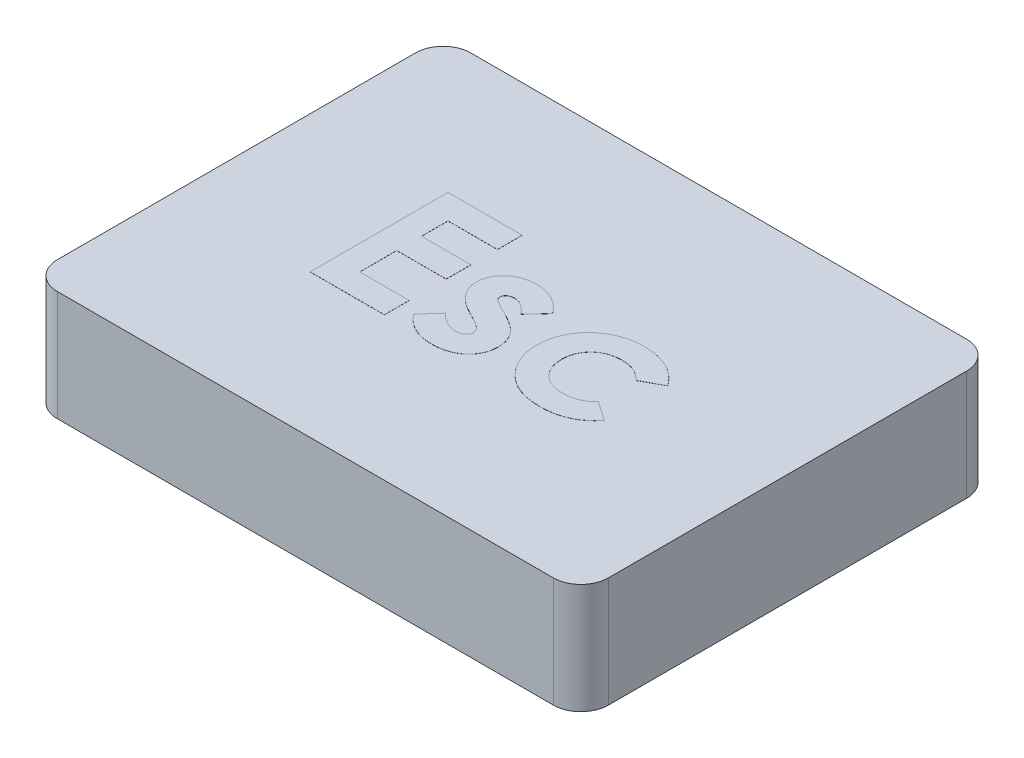
from build123d import *

# Parameters (mm, degrees)
SKETCH1_W           = 12.7
SKETCH1_H           = 9.525
BOSS_EXTRUDE1_DEPTH = 2.54
FILLET1_R           = 0.635
SHELL1_START        = 0.635
SHELL1_OUTLINE_W    = 1.905
SHELL1_OUTLINE_H    = 8.255
SHELL1_DEPTH        = 11.43
SKETCH2_R           = 2.54
BOSS_EXTRUDE2_DEPTH = 1.905
BOSS_EXTRUDE3_DEPTH = 0.00254


# Read off the part's stored shape, not the designer's step: Shell1
with BuildPart() as part:
    # Sketch1 → Boss-Extrude1 (new body)
    with BuildSketch(Plane(origin=(0, 0, 0), x_dir=(1, 0, 0), z_dir=(0, 1, 0))):
        with Locations((6.35, 4.7625)):
            Rectangle(SKETCH1_W, SKETCH1_H)
    extrude(amount=BOSS_EXTRUDE1_DEPTH)

    # Fillet1
    fillet1_edges = [part.edges().sort_by_distance(p)[0] for p in [
        (0, 1.27, -9.525),
        (12.7, 1.27, -9.525),
        (12.7, 1.27, 0),
        (0, 1.27, 0),
    ]]
    fillet(fillet1_edges, radius=FILLET1_R)

    # Shell1 outline → Shell1 (cut)
    with BuildSketch(Plane.YZ.offset(SHELL1_START)):
        with Locations((0.9525, -4.7625)):
            Rectangle(SHELL1_OUTLINE_W, SHELL1_OUTLINE_H)
    extrude(amount=SHELL1_DEPTH, mode=Mode.SUBTRACT)

    # Sketch2 → Boss-Extrude2 (add)
    with BuildSketch(Plane(origin=(0, 1.905, 0), x_dir=(-1, 0, 0), z_dir=(0, -1, 0))):
        with Locations(Location((-6.35, 4.7625, 0), (0, 0, 270))):
            Circle(SKETCH2_R)
    extrude(amount=BOSS_EXTRUDE2_DEPTH)

    # Sketch3 → Boss-Extrude3 (add)
    with BuildSketch(Plane(origin=(0, 2.54, 0), x_dir=(1, 0, 0), z_dir=(0, 1, 0))):
        Polygon((3.160346154, 6.477), (4.869961538, 6.477), (4.869961538, 5.907128205), (3.730217949, 5.907128205), (3.730217949, 5.296551282), (4.869961538, 5.296551282), (4.869961538, 4.726679487), (3.730217949, 4.726679487), (3.730217949, 3.871871795), (4.869961538, 3.871871795), (4.869961538, 3.302), (3.160346154, 3.302), align=None)
        with BuildLine():
            Line((6.783102564, 5.264114383), (6.434564904, 4.8895))
            add(Edge.make_bspline(
                [(6.434564904, 4.8895), (6.417160749, 4.908758641), (6.383873193, 4.945593127), (6.332913162, 4.995806763), (6.282712025, 5.037619888), (6.234205277, 5.072744656), (6.186402237, 5.099681155), (6.139700254, 5.119061362), (6.094076923, 5.131364206), (6.06383585, 5.132956762), (6.049138221, 5.133730769)],
                knots=[0, 0, 0, 0, 1.327646587, 2.539285, 3.655602211, 4.666613517, 5.598770349, 6.454635452, 7.248928967, 8, 8, 8, 8], degree=3))
            add(Edge.make_bspline(
                [(6.049138221, 5.133730769), (6.034265698, 5.133277506), (6.005789441, 5.132409647), (5.965603063, 5.124965596), (5.930296641, 5.112078571), (5.900421155, 5.094512355), (5.876418661, 5.072872582), (5.859613395, 5.048117191), (5.848328505, 5.021016135), (5.847373876, 5.001765207), (5.846884615, 4.991898838)],
                knots=[0, 0, 0, 0, 1.295068245, 2.479652818, 3.543291146, 4.55379989, 5.481948265, 6.332409746, 7.145336708, 8, 8, 8, 8], degree=3))
            add(Edge.make_bspline(
                [(5.846884615, 4.991898838), (5.848542275, 4.976947025), (5.851981726, 4.945923748), (5.875605984, 4.909941376), (5.906862583, 4.883397917), (5.942892404, 4.858697704), (5.991686109, 4.831080222), (6.028702252, 4.812169724), (6.049138221, 4.801729567)],
                knots=[0, 0, 0, 0, 0.916701701, 1.902049539, 2.5493345, 3.440293453, 4.586830489, 6, 6, 6, 6], degree=3))
            Line((6.049138221, 4.801729567), (6.255207933, 4.697422676))
            add(Edge.make_bspline(
                [(6.255207933, 4.697422676), (6.28142394, 4.684111039), (6.332287919, 4.658283963), (6.403797908, 4.616608507), (6.469845675, 4.576213663), (6.529106319, 4.534814403), (6.581942555, 4.493129972), (6.627979088, 4.450748166), (6.668332537, 4.409012568), (6.713332298, 4.353056541), (6.758345564, 4.278527666), (6.795872647, 4.181606337), (6.819803212, 4.077824904), (6.822450854, 4.005993817), (6.823807692, 3.969182492)],
                knots=[0, 0, 0, 0, 1.076693506, 2.088987655, 3.030641824, 3.911722491, 4.735175175, 5.493635918, 6.202154166, 6.859459289, 8.120623445, 9.372284821, 10.653373066, 12, 12, 12, 12], degree=3))
            add(Edge.make_bspline(
                [(6.823807692, 3.969182492), (6.822990188, 3.944348007), (6.821390116, 3.895740329), (6.811274798, 3.824194462), (6.793105067, 3.756164935), (6.769193729, 3.690591305), (6.736985872, 3.628659341), (6.697883956, 3.57006882), (6.652505415, 3.51405048), (6.599650601, 3.462520598), (6.541749036, 3.414495312), (6.477381675, 3.374102598), (6.409394564, 3.338588119), (6.335991589, 3.310854473), (6.258202687, 3.288369854), (6.175361045, 3.272788577), (6.087747764, 3.26298288), (6.027752836, 3.261867095), (5.996984776, 3.261294872)],
                knots=[0, 0, 0, 0, 0.976600749, 1.911466839, 2.833459288, 3.740827163, 4.650527853, 5.570709661, 6.506801416, 7.479409329, 8.468875524, 9.458587492, 10.461481786, 11.480119772, 12.538142914, 13.641687514, 14.790552763, 16, 16, 16, 16], degree=3))
            add(Edge.make_bspline(
                [(5.996984776, 3.261294872), (5.956219739, 3.262593012), (5.87620156, 3.265141146), (5.759340804, 3.282891086), (5.648993226, 3.313616532), (5.54506804, 3.356658951), (5.446928719, 3.411506792), (5.355976804, 3.479560957), (5.270635559, 3.559048346), (5.220983136, 3.620011473), (5.195602564, 3.651173678)],
                knots=[0, 0, 0, 0, 1.056901255, 2.07460411, 3.05625841, 4.019970729, 4.984811261, 5.963335951, 6.958928997, 8, 8, 8, 8], degree=3))
            Line((5.195602564, 3.651173678), (5.540960136, 4.034692308))
            add(Edge.make_bspline(
                [(5.540960136, 4.034692308), (5.557787123, 4.016944163), (5.591194196, 3.981708292), (5.647505021, 3.935245032), (5.707085862, 3.892897189), (5.770599997, 3.857338818), (5.834126965, 3.828627034), (5.895075849, 3.807089179), (5.952298001, 3.793554091), (5.989502369, 3.791456934), (6.007161058, 3.790461538)],
                knots=[0, 0, 0, 0, 1.087861918, 2.159761696, 3.243809206, 4.338405912, 5.394481878, 6.343674753, 7.213841449, 8, 8, 8, 8], degree=3))
            add(Edge.make_bspline(
                [(6.007161058, 3.790461538), (6.024810188, 3.790972669), (6.058736687, 3.791955203), (6.106955028, 3.802175487), (6.149693165, 3.819357293), (6.185936696, 3.843180303), (6.216083096, 3.87052548), (6.237324526, 3.901603435), (6.251370485, 3.934557895), (6.253077607, 3.9575984), (6.253935897, 3.969182492)],
                knots=[0, 0, 0, 0, 1.255011871, 2.412479185, 3.488767498, 4.514443302, 5.48617286, 6.365347346, 7.178144445, 8, 8, 8, 8], degree=3))
            add(Edge.make_bspline(
                [(6.253935897, 3.969182492), (6.253170047, 3.980091353), (6.25159761, 4.002489349), (6.23914857, 4.035550392), (6.219603332, 4.06828613), (6.192495154, 4.100788859), (6.157463327, 4.132794859), (6.11463322, 4.164047771), (6.064992926, 4.196214977), (6.028325779, 4.215414491), (6.009069111, 4.225497596)],
                knots=[0, 0, 0, 0, 0.704666567, 1.446816302, 2.258757648, 3.165368109, 4.175243826, 5.322435858, 6.59381024, 8, 8, 8, 8], degree=3))
            Line((6.009069111, 4.225497596), (5.820171875, 4.32090024))
            add(Edge.make_bspline(
                [(5.820171875, 4.32090024), (5.777322441, 4.343877821), (5.695067594, 4.387986161), (5.583889789, 4.463622589), (5.489793828, 4.544139073), (5.412703029, 4.62910305), (5.351276928, 4.71827609), (5.308428102, 4.812793541), (5.281472276, 4.911759356), (5.278506704, 4.979433254), (5.277012821, 5.013523437)],
                knots=[0, 0, 0, 0, 1.255999728, 2.41104856, 3.467751088, 4.449286722, 5.368722015, 6.253902015, 7.120417131, 8, 8, 8, 8], degree=3))
            add(Edge.make_bspline(
                [(5.277012821, 5.013523437), (5.277530887, 5.035617491), (5.278547935, 5.078991706), (5.289375024, 5.142689748), (5.305732433, 5.20391976), (5.328814498, 5.262778979), (5.358382221, 5.319325811), (5.394607812, 5.373309305), (5.437933218, 5.424631319), (5.486971412, 5.473126533), (5.541380828, 5.517293212), (5.599606904, 5.556435217), (5.661477421, 5.589776928), (5.727500139, 5.616359311), (5.796835876, 5.637517234), (5.869942321, 5.65189888), (5.946507567, 5.661045658), (5.998865985, 5.662271431), (6.025605569, 5.662897436)],
                knots=[0, 0, 0, 0, 0.959035663, 1.882742823, 2.798841253, 3.708806893, 4.623422363, 5.566085165, 6.527241613, 7.536786942, 8.55815439, 9.567237405, 10.580975912, 11.605536372, 12.654523293, 13.725718749, 14.838518481, 16, 16, 16, 16], degree=3))
            add(Edge.make_bspline(
                [(6.025605569, 5.662897436), (6.062573217, 5.661680308), (6.135947476, 5.659264525), (6.244160078, 5.639715992), (6.348682227, 5.60685942), (6.449220899, 5.561588559), (6.544482851, 5.504695952), (6.632373229, 5.435609112), (6.713486843, 5.356029271), (6.759666891, 5.295056923), (6.783102564, 5.264114383)],
                knots=[0, 0, 0, 0, 0.996590028, 1.978055413, 2.954661574, 3.945146934, 4.945404762, 5.939399542, 6.954276554, 8, 8, 8, 8], degree=3))
        make_face()
        with BuildLine():
            Line((9.551051282, 5.148995192), (9.079126202, 4.8895))
            add(Edge.make_bspline(
                [(9.079126202, 4.8895), (9.057494876, 4.911161867), (9.01591403, 4.952801421), (8.949235801, 5.00551049), (8.883749025, 5.049152133), (8.816753952, 5.081357424), (8.747651727, 5.105611095), (8.673949915, 5.121674834), (8.594788287, 5.132252235), (8.540032099, 5.133227763), (8.511798478, 5.133730769)],
                knots=[0, 0, 0, 0, 1.150764855, 2.212059359, 3.192108068, 4.105322427, 5.000809612, 5.941206042, 6.938435785, 8, 8, 8, 8], degree=3))
            add(Edge.make_bspline(
                [(8.511798478, 5.133730769), (8.485906298, 5.133105378), (8.435237474, 5.131881538), (8.361202281, 5.1227403), (8.290839417, 5.108382899), (8.224275186, 5.087377972), (8.161628147, 5.05962932), (8.102380236, 5.026792964), (8.047107185, 4.987586361), (7.996590296, 4.942566822), (7.950989924, 4.893001308), (7.910312066, 4.840137557), (7.876987294, 4.783191348), (7.848175961, 4.723501123), (7.826993518, 4.659945767), (7.811495928, 4.593101977), (7.802662445, 4.522966794), (7.80138263, 4.475052482), (7.800730769, 4.450647837)],
                knots=[0, 0, 0, 0, 1.121765476, 2.195200973, 3.227634963, 4.230038321, 5.213228299, 6.192116585, 7.160777141, 8.14345191, 9.118668839, 10.075979138, 11.027630062, 11.972829041, 12.943187208, 13.923755399, 14.94248691, 16, 16, 16, 16], degree=3))
            add(Edge.make_bspline(
                [(7.800730769, 4.450647837), (7.801419516, 4.426880072), (7.802764343, 4.380471829), (7.811026505, 4.31228706), (7.82536993, 4.24737807), (7.846876018, 4.186088013), (7.872653468, 4.127851883), (7.905025227, 4.073132841), (7.943092632, 4.021691945), (7.987056093, 3.973976291), (8.035756451, 3.931061914), (8.088259256, 3.893164076), (8.14440786, 3.861033721), (8.204856339, 3.835818613), (8.268619142, 3.815273576), (8.336122078, 3.800644704), (8.407293314, 3.792524669), (8.455808943, 3.791159879), (8.480633614, 3.790461538)],
                knots=[0, 0, 0, 0, 1.070556293, 2.090336998, 3.088792742, 4.058148387, 5.011235098, 5.952916408, 6.915475435, 7.888633318, 8.869583867, 9.83422472, 10.800707077, 11.776204622, 12.778807041, 13.814557445, 14.881744048, 16, 16, 16, 16], degree=3))
            add(Edge.make_bspline(
                [(8.480633614, 3.790461538), (8.511198733, 3.791160958), (8.570857404, 3.792526123), (8.657583799, 3.804105012), (8.73919215, 3.823252424), (8.815691111, 3.849753962), (8.886973659, 3.884405217), (8.952856638, 3.92672914), (9.014017325, 3.976413514), (9.049682868, 4.01514857), (9.067677885, 4.034692308)],
                knots=[0, 0, 0, 0, 1.116373375, 2.178998604, 3.189797796, 4.174590301, 5.13072713, 6.078291395, 7.030403691, 8, 8, 8, 8], degree=3))
            Line((9.067677885, 4.034692308), (9.510346154, 3.730675881))
            add(Edge.make_bspline(
                [(9.510346154, 3.730675881), (9.479662516, 3.693161254), (9.419110689, 3.619128988), (9.313464542, 3.523704101), (9.199757378, 3.441712919), (9.075702302, 3.376268597), (8.943105963, 3.324216005), (8.80093225, 3.28741999), (8.64942164, 3.265759744), (8.545366818, 3.262806952), (8.492081931, 3.261294872)],
                knots=[0, 0, 0, 0, 0.997876357, 1.969233105, 2.924898516, 3.881013542, 4.852507933, 5.855329832, 6.901747111, 8, 8, 8, 8], degree=3))
            add(Edge.make_bspline(
                [(8.492081931, 3.261294872), (8.444122228, 3.262403558), (8.350451639, 3.264568944), (8.213929083, 3.281151716), (8.085522531, 3.309083137), (7.964967829, 3.347874142), (7.852374889, 3.398123017), (7.748108859, 3.460450398), (7.651466468, 3.533122564), (7.564191533, 3.616482815), (7.486322264, 3.707221348), (7.418342113, 3.80278345), (7.359549768, 3.901456927), (7.313427231, 4.004884161), (7.275732406, 4.111453062), (7.250274505, 4.22243751), (7.233483451, 4.336923312), (7.231740841, 4.414546076), (7.230858974, 4.453827925)],
                knots=[0, 0, 0, 0, 1.183377041, 2.311265848, 3.387807024, 4.421911742, 5.431260577, 6.423665966, 7.413571885, 8.409103097, 9.395976332, 10.359992013, 11.300391101, 12.225292883, 13.150239058, 14.085544813, 15.031169026, 16, 16, 16, 16], degree=3))
            add(Edge.make_bspline(
                [(7.230858974, 4.453827925), (7.231331397, 4.481195922), (7.23226712, 4.535403508), (7.24025524, 4.61590782), (7.252682071, 4.695046005), (7.27135813, 4.772262556), (7.294326385, 4.847932099), (7.32224741, 4.922039423), (7.356222512, 4.994202122), (7.394121842, 5.065034055), (7.437316523, 5.132665364), (7.484441024, 5.1970662), (7.535428951, 5.257842136), (7.590879282, 5.314426759), (7.650405384, 5.367224953), (7.713141901, 5.417307896), (7.781118955, 5.462092695), (7.851973403, 5.504198679), (7.926315581, 5.541681114), (8.003291029, 5.574033398), (8.082304898, 5.601521328), (8.16354658, 5.623622179), (8.24666737, 5.641837332), (8.332406896, 5.653397417), (8.420055807, 5.661522752), (8.479342283, 5.662436445), (8.509254407, 5.662897436)],
                knots=[0, 0, 0, 0, 1.00272354, 1.986087015, 2.96193297, 3.936200312, 4.894695956, 5.858592327, 6.835334787, 7.815655071, 8.800643866, 9.773423113, 10.738352213, 11.705312252, 12.673769326, 13.65298065, 14.64420052, 15.654211674, 16.672258995, 17.692438602, 18.712115155, 19.735602823, 20.776372304, 21.827874031, 22.90408564, 24, 24, 24, 24], degree=3))
            add(Edge.make_bspline(
                [(8.509254407, 5.662897436), (8.537038932, 5.662583308), (8.591835892, 5.661963782), (8.672758614, 5.655485774), (8.751473928, 5.644482593), (8.828115795, 5.629925848), (8.902916972, 5.611887505), (8.974874928, 5.587842999), (9.044973447, 5.56055339), (9.13526108, 5.51934893), (9.241693675, 5.457844605), (9.358528149, 5.369633843), (9.462700226, 5.266440118), (9.521444398, 5.188351578), (9.551051282, 5.148995192)],
                knots=[0, 0, 0, 0, 0.826738014, 1.630502179, 2.413926014, 3.191023582, 3.95155221, 4.701751672, 5.446919844, 6.189438973, 7.653650558, 9.094719814, 10.535747635, 12, 12, 12, 12], degree=3))
        make_face()
    extrude(amount=BOSS_EXTRUDE3_DEPTH)


solid = part.part
